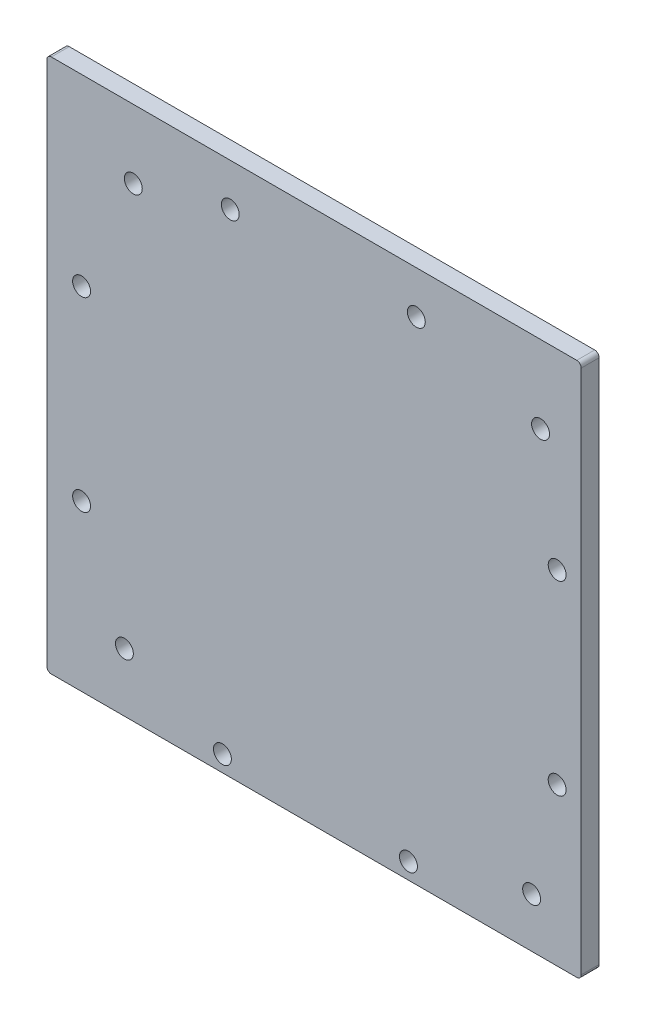
from build123d import *

# Parameters (mm, degrees)
BOSS_EXTRUDE1_DEPTH = 3.175
CUT_EXTRUDE2_REACH  = 69.068
SKETCH3_R           = 1.5875


with BuildPart() as part:
    # Sketch1 → Boss-Extrude1 (new body)
    with BuildSketch(Plane.XY):
        with BuildLine():
            Line((46.57725, -47.371), (-46.57725, -47.371))
            ThreePointArc((-46.57725, -47.371), (-47.138516008, -47.138516008), (-47.371, -46.57725))
            Line((-47.371, -46.57725), (-47.371, 46.57725))
            ThreePointArc((-47.371, 46.57725), (-47.138516008, 47.138516008), (-46.57725, 47.371))
            Line((-46.57725, 47.371), (46.57725, 47.371))
            ThreePointArc((46.57725, 47.371), (47.138516008, 47.138516008), (47.371, 46.57725))
            Line((47.371, 46.57725), (47.371, -46.57725))
            ThreePointArc((47.371, -46.57725), (47.138516008, -47.138516008), (46.57725, -47.371))
        make_face()
    extrude(amount=BOSS_EXTRUDE1_DEPTH)

    # Sketch3 → Cut-Extrude2 (cut, up to next)
    with BuildSketch(Plane.XY.offset(3.175), mode=Mode.PRIVATE) as cut_extrude2_sk1:
        with Locations((16.73906764, -44.496137938)):
            Circle(SKETCH3_R)
    cut_extrude2_tool1 = extrude(cut_extrude2_sk1.sketch, amount=-CUT_EXTRUDE2_REACH, mode=Mode.PRIVATE) & part.part
    # Sketch3 → Cut-Extrude2 (cut, up to next)
    with BuildSketch(Plane.XY.offset(3.175), mode=Mode.PRIVATE) as cut_extrude2_sk2:
        with Locations((38.574305682, -38.574305682)):
            Circle(SKETCH3_R)
    cut_extrude2_tool2 = extrude(cut_extrude2_sk2.sketch, amount=-CUT_EXTRUDE2_REACH, mode=Mode.PRIVATE) & part.part
    # Sketch3 → Cut-Extrude2 (cut, up to next)
    with BuildSketch(Plane.XY.offset(3.175), mode=Mode.PRIVATE) as cut_extrude2_sk3:
        with Locations((43.101853375, -19.527636765)):
            Circle(SKETCH3_R)
    cut_extrude2_tool3 = extrude(cut_extrude2_sk3.sketch, amount=-CUT_EXTRUDE2_REACH, mode=Mode.PRIVATE) & part.part
    # Sketch3 → Cut-Extrude2 (cut, up to next)
    with BuildSketch(Plane.XY.offset(3.175), mode=Mode.PRIVATE) as cut_extrude2_sk4:
        with Locations((43.101853375, 13.456843967)):
            Circle(SKETCH3_R)
    cut_extrude2_tool4 = extrude(cut_extrude2_sk4.sketch, amount=-CUT_EXTRUDE2_REACH, mode=Mode.PRIVATE) & part.part
    # Sketch3 → Cut-Extrude2 (cut, up to next)
    with BuildSketch(Plane.XY.offset(3.175), mode=Mode.PRIVATE) as cut_extrude2_sk5:
        with Locations((40.154577439, 33.621873034)):
            Circle(SKETCH3_R)
    cut_extrude2_tool5 = extrude(cut_extrude2_sk5.sketch, amount=-CUT_EXTRUDE2_REACH, mode=Mode.PRIVATE) & part.part
    # Sketch3 → Cut-Extrude2 (cut, up to next)
    with BuildSketch(Plane.XY.offset(3.175), mode=Mode.PRIVATE) as cut_extrude2_sk6:
        with Locations((18.133352203, 39.819629702)):
            Circle(SKETCH3_R)
    cut_extrude2_tool6 = extrude(cut_extrude2_sk6.sketch, amount=-CUT_EXTRUDE2_REACH, mode=Mode.PRIVATE) & part.part
    # Sketch3 → Cut-Extrude2 (cut, up to next)
    with BuildSketch(Plane.XY.offset(3.175), mode=Mode.PRIVATE) as cut_extrude2_sk7:
        with Locations((-14.85112853, 39.819629702)):
            Circle(SKETCH3_R)
    cut_extrude2_tool7 = extrude(cut_extrude2_sk7.sketch, amount=-CUT_EXTRUDE2_REACH, mode=Mode.PRIVATE) & part.part
    # Sketch3 → Cut-Extrude2 (cut, up to next)
    with BuildSketch(Plane.XY.offset(3.175), mode=Mode.PRIVATE) as cut_extrude2_sk8:
        with Locations((-32.041601278, 35.202144791)):
            Circle(SKETCH3_R)
    cut_extrude2_tool8 = extrude(cut_extrude2_sk8.sketch, amount=-CUT_EXTRUDE2_REACH, mode=Mode.PRIVATE) & part.part
    # Sketch3 → Cut-Extrude2 (cut, up to next)
    with BuildSketch(Plane.XY.offset(3.175), mode=Mode.PRIVATE) as cut_extrude2_sk9:
        with Locations((-41.213914265, 14.85112853)):
            Circle(SKETCH3_R)
    cut_extrude2_tool9 = extrude(cut_extrude2_sk9.sketch, amount=-CUT_EXTRUDE2_REACH, mode=Mode.PRIVATE) & part.part
    # Sketch3 → Cut-Extrude2 (cut, up to next)
    with BuildSketch(Plane.XY.offset(3.175), mode=Mode.PRIVATE) as cut_extrude2_sk10:
        with Locations((-41.213914265, -18.133352203)):
            Circle(SKETCH3_R)
    cut_extrude2_tool10 = extrude(cut_extrude2_sk10.sketch, amount=-CUT_EXTRUDE2_REACH, mode=Mode.PRIVATE) & part.part
    # Sketch3 → Cut-Extrude2 (cut, up to next)
    with BuildSketch(Plane.XY.offset(3.175), mode=Mode.PRIVATE) as cut_extrude2_sk11:
        with Locations((-16.245413093, -44.496137938)):
            Circle(SKETCH3_R)
    cut_extrude2_tool11 = extrude(cut_extrude2_sk11.sketch, amount=-CUT_EXTRUDE2_REACH, mode=Mode.PRIVATE) & part.part
    # Sketch3 → Cut-Extrude2 (cut, up to next)
    with BuildSketch(Plane.XY.offset(3.175), mode=Mode.PRIVATE) as cut_extrude2_sk12:
        with Locations((-33.621873034, -36.994033926)):
            Circle(SKETCH3_R)
    cut_extrude2_tool12 = extrude(cut_extrude2_sk12.sketch, amount=-CUT_EXTRUDE2_REACH, mode=Mode.PRIVATE) & part.part
    add(cut_extrude2_tool1.solids().sort_by_distance((16.739068, -44.496138, 3.175))[0], mode=Mode.SUBTRACT)
    add(cut_extrude2_tool2.solids().sort_by_distance((38.574306, -38.574306, 3.175))[0], mode=Mode.SUBTRACT)
    add(cut_extrude2_tool3.solids().sort_by_distance((43.101853, -19.527637, 3.175))[0], mode=Mode.SUBTRACT)
    add(cut_extrude2_tool4.solids().sort_by_distance((43.101853, 13.456844, 3.175))[0], mode=Mode.SUBTRACT)
    add(cut_extrude2_tool5.solids().sort_by_distance((40.154577, 33.621873, 3.175))[0], mode=Mode.SUBTRACT)
    add(cut_extrude2_tool6.solids().sort_by_distance((18.133352, 39.81963, 3.175))[0], mode=Mode.SUBTRACT)
    add(cut_extrude2_tool7.solids().sort_by_distance((-14.851129, 39.81963, 3.175))[0], mode=Mode.SUBTRACT)
    add(cut_extrude2_tool8.solids().sort_by_distance((-32.041601, 35.202145, 3.175))[0], mode=Mode.SUBTRACT)
    add(cut_extrude2_tool9.solids().sort_by_distance((-41.213914, 14.851129, 3.175))[0], mode=Mode.SUBTRACT)
    add(cut_extrude2_tool10.solids().sort_by_distance((-41.213914, -18.133352, 3.175))[0], mode=Mode.SUBTRACT)
    add(cut_extrude2_tool11.solids().sort_by_distance((-16.245413, -44.496138, 3.175))[0], mode=Mode.SUBTRACT)
    add(cut_extrude2_tool12.solids().sort_by_distance((-33.621873, -36.994034, 3.175))[0], mode=Mode.SUBTRACT)


solid = part.part
